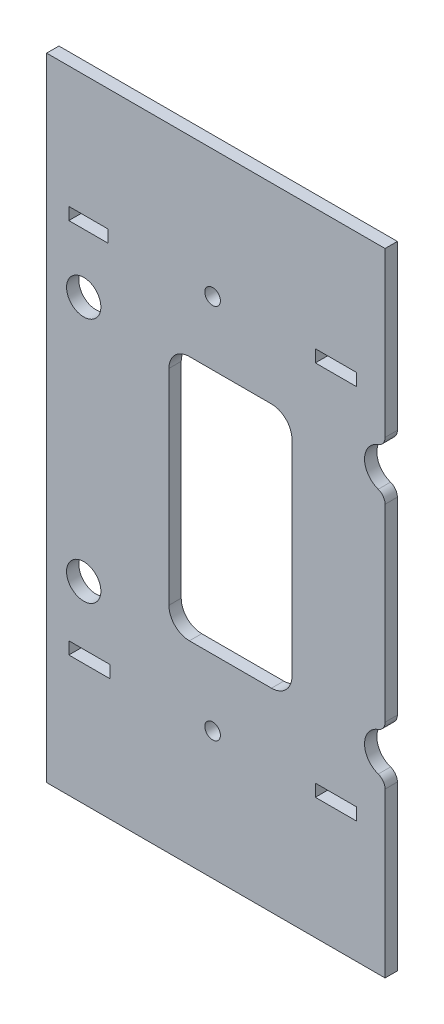
from build123d import *

# Parameters (mm, degrees)
SALIENTE_EXTRUIR1_START = -1.5
SALIENTE_EXTRUIR1_DEPTH = 3
CROQUIS4_W              = 30
CROQUIS4_H              = 60
CORTAR_EXTRUIR3_DEPTH   = 10
CROQUIS5_W              = 9.999999994
CROQUIS5_H              = 3
CROQUIS5_W_2            = 9.587122789
CORTAR_EXTRUIR4_DEPTH   = 10
CROQUIS6_R              = 1.9
CORTAR_EXTRUIR5_DEPTH   = 10
REDONDEO1_R             = 5
CROQUIS7_W              = 82.5
CROQUIS7_H              = 3
SALIENTE_EXTRUIR2_DEPTH = 2
CROQUIS8_W              = 82.49989544
CROQUIS8_H              = 3
SALIENTE_EXTRUIR3_DEPTH = 2
CROQUIS9_R              = 4.181897372
CORTAR_EXTRUIR6_DEPTH   = 10


# Read off the part's stored shape, not the designer's step: Saliente-Extruir1
with BuildPart() as part:
    # Saliente-Extruir1 outline → Saliente-Extruir1 (new body)
    with BuildSketch(Plane.XY.offset(SALIENTE_EXTRUIR1_START)):
        with BuildLine():
            ThreePointArc((492.916449572, 98.009593947), (492.452410006, 99.442022929), (491.249851225, 100.348134338))
            ThreePointArc((491.249851225, 100.348134338), (487.916517891, 105.062179546), (491.249851225, 109.776224754))
            ThreePointArc((491.249851225, 109.776224754), (492.452037009, 110.681812922), (492.916439741, 112.113480025))
            Line((492.916439741, 112.113480025), (492.916413331, 149.999679341))
            Line((492.916413331, 149.999679341), (410.416517891, 149.999679341))
            Line((410.416517891, 149.999679341), (410.416517891, -0.000320659))
            Line((410.416517891, -0.000320659), (492.916517891, -0.000320659))
            Line((492.916517891, -0.000320659), (492.916491488, 37.877716604))
            ThreePointArc((492.916491488, 37.877716604), (492.45443711, 39.314289338), (491.249851225, 40.223249354))
            ThreePointArc((491.249851225, 40.223249354), (487.916517891, 44.937294562), (491.249851225, 49.65133977))
            ThreePointArc((491.249851225, 49.65133977), (492.453865854, 50.559496169), (492.916481647, 51.994900607))
            Line((492.916481647, 51.994900607), (492.916449572, 98.009593947))
        make_face()
    extrude(amount=SALIENTE_EXTRUIR1_DEPTH)

    # Croquis4 → Cortar-Extruir3 (cut)
    with BuildSketch(Plane.XY.offset(1.5)):
        with Locations((455.222459901, 75.336681949)):
            Rectangle(CROQUIS4_W, CROQUIS4_H)
    extrude(amount=-CORTAR_EXTRUIR3_DEPTH, mode=Mode.SUBTRACT)

    # Croquis5 → Cortar-Extruir4 (cut)
    with BuildSketch(Plane(origin=(0, 0, -1.5), x_dir=(-1, 0, 0), z_dir=(0, 0, -1))):
        with Locations((-420.82939509, 29.146675475)):
            Rectangle(CROQUIS5_W, CROQUIS5_H)
        with Locations((-480.921167725, 29.146675475)):
            Rectangle(CROQUIS5_W, CROQUIS5_H)
        with Locations((-480.921167725, 120.852683208)):
            Rectangle(CROQUIS5_W, CROQUIS5_H)
        with Locations((-420.622956488, 120.852683208)):
            Rectangle(CROQUIS5_W_2, CROQUIS5_H)
    extrude(amount=-CORTAR_EXTRUIR4_DEPTH, mode=Mode.SUBTRACT)

    # Croquis6 → Cortar-Extruir5 (cut)
    with BuildSketch(Plane.XY.offset(1.5)):
        with Locations((450.875281407, 29.146675475)):
            Circle(CROQUIS6_R)
        with Locations((450.875281407, 120.857819079)):
            Circle(CROQUIS6_R)
    extrude(amount=-CORTAR_EXTRUIR5_DEPTH, mode=Mode.SUBTRACT)

    # Redondeo1
    redondeo1_edges = [part.edges().sort_by_distance(p)[0] for p in [
        (470.222459901, 105.336681949, 0),
        (470.222459901, 45.336681949, 0),
        (440.222459901, 45.336681949, 0),
        (440.222459901, 105.336681949, 0),
    ]]
    fillet(redondeo1_edges, radius=REDONDEO1_R)

    # Croquis7 → Saliente-Extruir2 (add)
    with BuildSketch(Plane.XZ.offset(0.000320659)):
        with Locations((451.666517891, 0)):
            Rectangle(CROQUIS7_W, CROQUIS7_H)
    extrude(amount=SALIENTE_EXTRUIR2_DEPTH)

    # Croquis8 → Saliente-Extruir3 (add)
    with BuildSketch(Plane(origin=(0, 149.999679341, 0), x_dir=(1, 0, 0), z_dir=(0, 1, 0))):
        with Locations((451.666465611, 0)):
            Rectangle(CROQUIS8_W, CROQUIS8_H)
    extrude(amount=SALIENTE_EXTRUIR3_DEPTH)

    # Croquis9 → Cortar-Extruir6 (cut)
    with BuildSketch(Plane(origin=(0, 0, -1.5), x_dir=(-1, 0, 0), z_dir=(0, 0, -1))):
        with Locations((-419.456517891, 44.999679341)):
            Circle(CROQUIS9_R)
        with Locations(Location((-419.454650283, 105.000242051, 0), (0, 0, 180))):
            Circle(CROQUIS9_R)
    extrude(amount=-CORTAR_EXTRUIR6_DEPTH, mode=Mode.SUBTRACT)


solid = part.part
